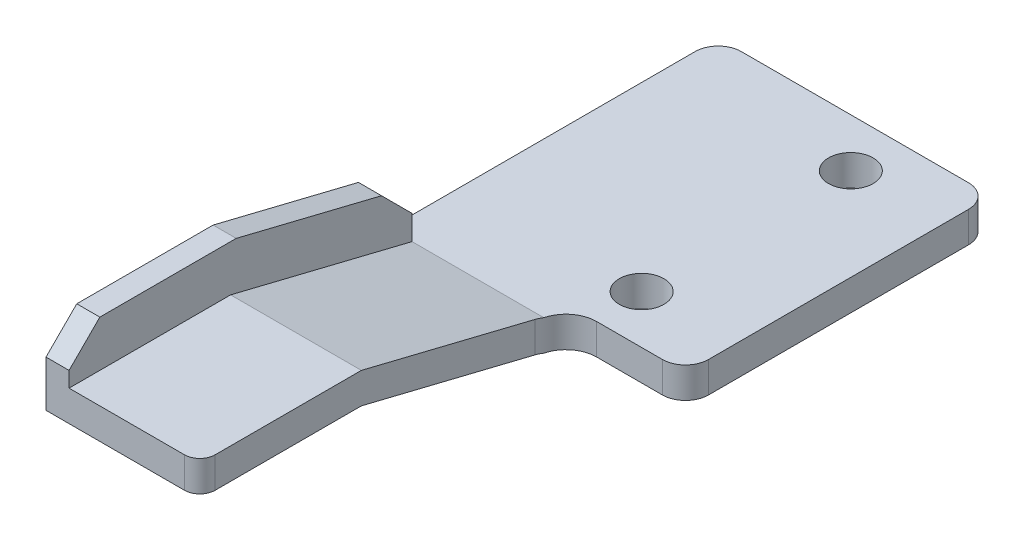
from build123d import *

# Parameters (mm, degrees)
SKETCH1_W           = 17.77
SKETCH1_H           = 19.9
SKETCH1_R           = 1.45
BOSS_EXTRUDE1_DEPTH = 2
BOSS_EXTRUDE2_DEPTH = 10
BOSS_EXTRUDE4_DEPTH = 1.5
CHAMFER1_SIZE       = 2
CHAMFER2_SIZE       = 1.5
CHAMFER2_SIZE2      = 2.047943534
FILLET1_R           = 1.5
FILLET2_R           = 1
FILLET3_R           = 2


with BuildPart() as part:
    # Sketch1 → Boss-Extrude1 (new body)
    with BuildSketch(Plane(origin=(0, 0, 0), x_dir=(1, 0, 0), z_dir=(0, 1, 0))):
        Rectangle(SKETCH1_W, SKETCH1_H)
        with Locations((2.885, 6.8)):
            Circle(SKETCH1_R, mode=Mode.SUBTRACT)
        with Locations((2.885, -6.8)):
            Circle(SKETCH1_R, mode=Mode.SUBTRACT)
    extrude(amount=BOSS_EXTRUDE1_DEPTH)

    # Sketch2 → Boss-Extrude2 (add)
    with BuildSketch(Plane.ZY.offset(8.885)):
        Polygon((9.95, 2), (11.45, 2), (23.25, 4.9), (33.75, 4.9), (33.75, 2.9), (23.25, 2.9), (11.45, 0), (9.95, 0), align=None)
    extrude(amount=-BOSS_EXTRUDE2_DEPTH)

    # Sketch4 → Boss-Extrude4 (add)
    with BuildSketch(Plane.ZY.offset(8.885)):
        Polygon((33.75, 4.9), (23.25, 4.9), (11.45, 2), (11.45, 5.089270755), (22.886760378, 7.9), (33.75, 7.9), align=None)
    extrude(amount=-BOSS_EXTRUDE4_DEPTH)

    # Chamfer1
    chamfer1_edges = [part.edges().sort_by_distance(p)[0] for p in [
        (-8.135, 7.9, 33.75),
    ]]
    chamfer(chamfer1_edges, length=CHAMFER1_SIZE)

    # Chamfer2
    chamfer2_edges = [part.edges().sort_by_distance(p)[0] for p in [
        (-8.135, 5.089270755, 11.45),
    ]]
    chamfer2_side = [part.faces().sort_by_distance(p)[0] for p in [
        (-8.135, 3.544635377, 11.45),
    ]]
    chamfer(chamfer2_edges, length=CHAMFER2_SIZE, length2=CHAMFER2_SIZE2, reference=chamfer2_side[0])

    # Fillet1
    fillet1_edges = [part.edges().sort_by_distance(p)[0] for p in [
        (8.885, 1, 9.95),
        (8.885, 1, -9.95),
        (-8.885, 1, -9.95),
    ]]
    fillet(fillet1_edges, radius=FILLET1_R)

    # Fillet2
    fillet2_edges = [part.edges().sort_by_distance(p)[0] for p in [
        (1.115, 3.9, 33.75),
    ]]
    fillet(fillet2_edges, radius=FILLET2_R)

    # Fillet3
    fillet3_edges = [part.edges().sort_by_distance(p)[0] for p in [
        (1.115, 1, 9.95),
    ]]
    fillet(fillet3_edges, radius=FILLET3_R)


solid = part.part
